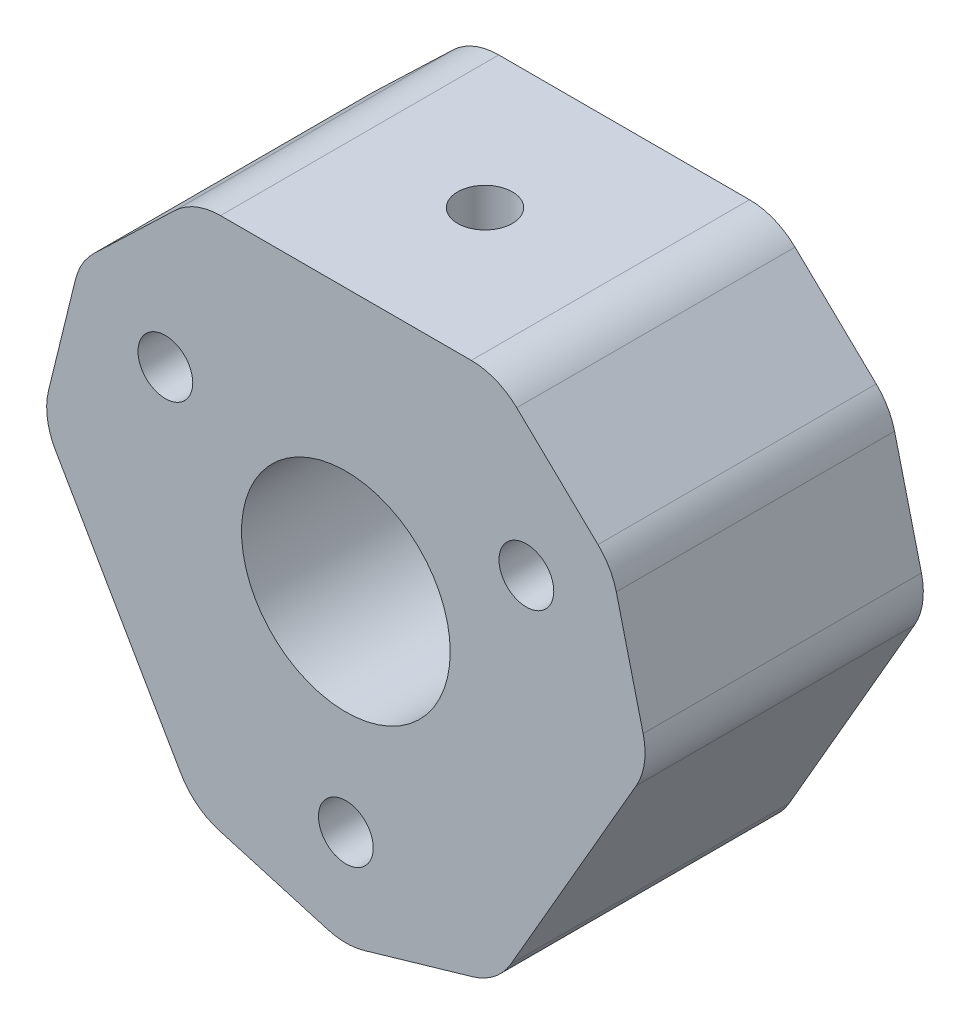
from build123d import *

# Parameters (mm, degrees)
SKETCH1_R               = 4.7625
SKETCH1_R_2             = 1.25
BOSS_EXTRUDE1_DEPTH     = 12.7
CUT_EXTRUDE1_REACH      = 33.906
CUT_EXTRUDE1_END_RADIUS = 4.7625
SKETCH2_R               = 1.25


with BuildPart() as part:
    # Sketch1 → Boss-Extrude1 (new body)
    with BuildSketch(Plane.XY):
        with BuildLine():
            Line((-13.253372163, -1.044486042), (-7.531237528, -10.955513958))
            ThreePointArc((-7.531237528, -10.955513958), (-6.784217233, -11.816359568), (-5.770008435, -12.336431676))
            Line((-5.770008435, -12.336431676), (-0.836847118, -13.76941319))
            ThreePointArc((-0.836847118, -13.76941319), (0, -13.888495471), (0.836847118, -13.76941319))
            Line((0.836847118, -13.76941319), (5.770008435, -12.336431676))
            ThreePointArc((5.770008435, -12.336431676), (6.784217233, -11.816359568), (7.531237528, -10.955513958))
            Line((7.531237528, -10.955513958), (13.253372163, -1.044486042))
            ThreePointArc((13.253372163, -1.044486042), (13.625376182, 0.032875315), (13.568667441, 1.171241953))
            Line((13.568667441, 1.171241953), (12.343085176, 6.159975731))
            ThreePointArc((12.343085176, 6.159975731), (12.027789898, 6.944247736), (11.506238058, 7.609437458))
            Line((11.506238058, 7.609437458), (7.798659006, 11.165189723))
            ThreePointArc((7.798659006, 11.165189723), (6.841158949, 11.783484253), (5.722134635, 12))
            Line((5.722134635, 12), (-5.722134635, 12))
            ThreePointArc((-5.722134635, 12), (-6.841158949, 11.783484253), (-7.798659006, 11.165189723))
            Line((-7.798659006, 11.165189723), (-11.506238058, 7.609437458))
            ThreePointArc((-11.506238058, 7.609437458), (-12.027789898, 6.944247736), (-12.343085176, 6.159975731))
            Line((-12.343085176, 6.159975731), (-13.568667441, 1.171241953))
            ThreePointArc((-13.568667441, 1.171241953), (-13.625376182, 0.032875315), (-13.253372163, -1.044486042))
        make_face()
        Circle(SKETCH1_R, mode=Mode.SUBTRACT)
        with Locations((-8.238066653, 4.75625)):
            Circle(SKETCH1_R_2, mode=Mode.SUBTRACT)
        with Locations((8.238066653, 4.75625)):
            Circle(SKETCH1_R_2, mode=Mode.SUBTRACT)
        with Locations((0, -9.5125)):
            Circle(SKETCH1_R_2, mode=Mode.SUBTRACT)
    extrude(amount=BOSS_EXTRUDE1_DEPTH)

    # Cut-Extrude1: up to this cylinder (the profile starts outside it)
    cut_extrude1_end = Plane(origin=(0, 0, 6.35), z_dir=(0, 0, -1)) * Cylinder(CUT_EXTRUDE1_END_RADIUS, 78.337, mode=Mode.PRIVATE)
    # Sketch2 → Cut-Extrude1 (cut, up to the surface)
    with BuildSketch(Plane(origin=(0, 12, 0), x_dir=(1, 0, 0), z_dir=(0, 1, 0)), mode=Mode.PRIVATE) as cut_extrude1_sk1:
        with Locations((0, -6.35)):
            Circle(SKETCH2_R)
    cut_extrude1_tool1 = extrude(cut_extrude1_sk1.sketch, amount=-CUT_EXTRUDE1_REACH, mode=Mode.PRIVATE) - cut_extrude1_end
    add(cut_extrude1_tool1.solids().sort_by_distance((0, 12, 6.35))[0], mode=Mode.SUBTRACT)


solid = part.part
